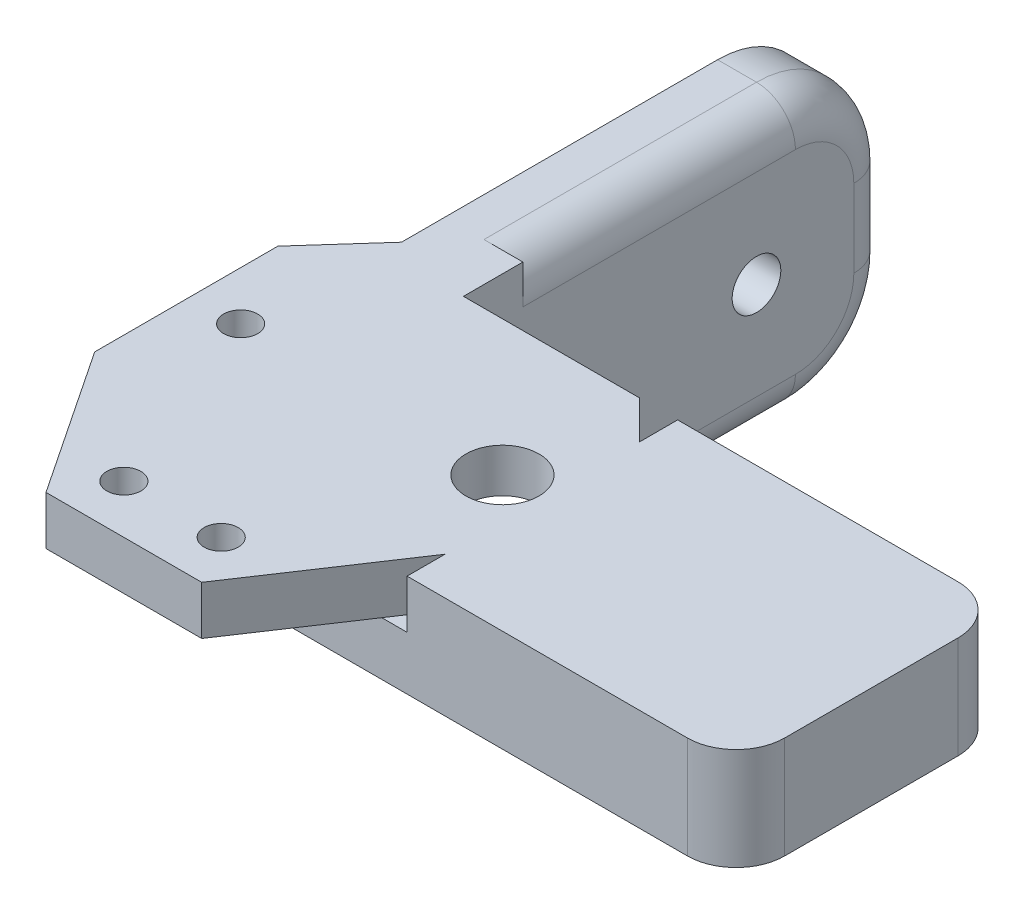
from build123d import *

# Parameters (mm, degrees)
SKETCH1_R               = 1.75
SKETCH1_W               = 7.2
SKETCH1_H               = 10.8
BOSS_EXTRUDE2_DEPTH     = 5
FILLET1_R               = 5.4
FILLET2_R               = 5.4
FILLET3_RADIUS          = 10
FILLET3_LENGTH          = 5
SKETCH2_W               = 35
SKETCH2_H               = 19.782608696
SKETCH2_W_2             = 23
SKETCH2_H_2             = 13
BOSS_EXTRUDE3_DEPTH     = 5.5
SKETCH3_W               = 23
SKETCH3_H               = 13
CUT_EXTRUDE1_DEPTH      = 3.5
CUT_EXTRUDE2_DEPTH      = 76.201396264
CUT_EXTRUDE2_DEPTH_BACK = 76.201396264
SKETCH6_W               = 13.4
SKETCH6_H               = 0.108695652
CUT_EXTRUDE3_DEPTH      = 13.5
SKETCH7_W               = 8
SKETCH7_H               = 28
BOSS_EXTRUDE5_DEPTH     = 38
SKETCH8_R               = 2.5
CUT_EXTRUDE4_DEPTH      = 32
FILLET5_R               = 10
SKETCH9_R               = 1
CUT_EXTRUDE5_DEPTH      = 7
BOSS_EXTRUDE6_START     = -8
BOSS_EXTRUDE6_DEPTH     = 8
CUT_EXTRUDE8_DEPTH      = 97.444595494
FILLET8_R               = 8
FILLET10_R              = 4
BOSS_EXTRUDE7_START     = -1.5
BOSS_EXTRUDE7_OUTLINE_W = 23
BOSS_EXTRUDE7_OUTLINE_H = 13
BOSS_EXTRUDE7_DEPTH     = 1.5
SKETCH15_R              = 1
BOSS_EXTRUDE8_DEPTH     = 7
SKETCH16_W              = 23
SKETCH16_H              = 13
BOSS_EXTRUDE9_DEPTH     = 9
SKETCH23_W              = 22.4
SKETCH23_H              = 19.782608696
BOSS_EXTRUDE11_DEPTH    = 10.5
SKETCH32_W              = 2
SKETCH32_H              = 19.782608696
CUT_EXTRUDE10_DEPTH     = 112.132758447
SKETCH33_W              = 21.6
SKETCH33_H              = 4.008695652
BOSS_EXTRUDE26_DEPTH    = 5.5
SKETCH34_W              = 33.8
SKETCH34_H              = 4.008695652
BOSS_EXTRUDE27_DEPTH    = 10.5
SKETCH39_W              = 41.4
SKETCH39_H              = 21
CUT_EXTRUDE15_DEPTH     = 6
SKETCH40_R              = 1
CUT_EXTRUDE16_DEPTH     = 7
SKETCH41_R              = 1.75
SKETCH41_R_2            = 3.75
CUT_EXTRUDE17_DEPTH     = 111.965264835
CUT_EXTRUDE18_DEPTH     = 10
FILLET12_R              = 5
BOSS_EXTRUDE28_REACH    = 109.184


with BuildPart() as part:
    # Sketch1 → Boss-Extrude2 (new body)
    # profile 1 of 2: a face of its own
    with BuildSketch(Plane(origin=(0, 0, 0), x_dir=(1, 0, 0), z_dir=(0, 1, 0))):
        Polygon((26, 45), (10, 45), (0, 33.819660113), (0, 15), (10, 0), (26, 0), (36, 15), (60, 15), (60, 35), (36, 35), align=None)
        with Locations(Location((13, 5, 0), (0, 0, 270))):
            Circle(SKETCH1_R, mode=Mode.SUBTRACT)
        with Locations(Location((23, 5, 0), (0, 0, 270))):
            Circle(SKETCH1_R, mode=Mode.SUBTRACT)
        with Locations(Location((5, 25, 0), (0, 0, 270))):
            Circle(SKETCH1_R, mode=Mode.SUBTRACT)
        Polygon((26.5, 30.4), (37.3, 30.4), (44.5, 30.4), (44.5, 19.6), (37.3, 19.6), (26.5, 19.6), align=None, mode=Mode.SUBTRACT)
    # profile 2 of 2: a face of its own
    with BuildSketch(Plane(origin=(0, 0, 0), x_dir=(1, 0, 0), z_dir=(0, 1, 0))):
        with Locations((40.9, 25)):
            Rectangle(SKETCH1_W, SKETCH1_H)
    extrude(amount=BOSS_EXTRUDE2_DEPTH)

    # Fillet1
    fillet1_edges = [part.edges().sort_by_distance(p)[0] for p in [
        (37.3, 2.5, -19.6),
        (37.3, 2.5, -30.4),
    ]]
    fillet(fillet1_edges, radius=FILLET1_R - 0.0001)  # a hair under: the kernel refuses the full size

    # Fillet2
    fillet2_edges = [part.edges().sort_by_distance(p)[0] for p in [
        (26.5, 2.5, -30.4),
        (26.5, 2.5, -19.6),
    ]]
    fillet(fillet2_edges, radius=FILLET2_R - 0.0001)  # a hair under: the kernel refuses the full size

    # Fillet3: full round fillet: the end face becomes a half cylinder, R = half its width
    fillet3_face = Plane((60, 2.5, -25), x_dir=(0, 1, 0), z_dir=(1, 0, 0))  # on the end face: x along it, z out of the body
    fillet3_slab = fillet3_face.offset(-FILLET3_RADIUS / 2) * Box(FILLET3_LENGTH, 2 * FILLET3_RADIUS, FILLET3_RADIUS, mode=Mode.PRIVATE)  # the body's end, R deep
    fillet3_round = Plane((50, 2.5, -25), x_dir=(1, 0, 0), z_dir=(0, 1, 0)) * Cylinder(FILLET3_RADIUS, FILLET3_LENGTH, mode=Mode.PRIVATE)  # its axis R under the face
    add(fillet3_slab - fillet3_round, mode=Mode.SUBTRACT)

    # Sketch2 → Boss-Extrude3 (add)
    with BuildSketch(Plane.XZ):
        with Locations((31.9, -25)):
            Rectangle(SKETCH2_W, SKETCH2_H)
        with Locations((31.9, -25)):
            Rectangle(SKETCH2_W_2, SKETCH2_H_2, mode=Mode.SUBTRACT)
    extrude(amount=BOSS_EXTRUDE3_DEPTH)

    # Sketch3 → Cut-Extrude1 (cut)
    with BuildSketch(Plane.XZ):
        with Locations((31.9, -25)):
            Rectangle(SKETCH3_W, SKETCH3_H)
    extrude(amount=-CUT_EXTRUDE1_DEPTH, mode=Mode.SUBTRACT)

    # Sketch4 → Cut-Extrude2 (cut, two sides: drawn at the far end of the back side and taken through both)
    with BuildSketch(Plane.XZ.offset(-CUT_EXTRUDE2_DEPTH_BACK)):
        with BuildLine():
            Line((49.4, -15), (49.4, -35))
            Line((49.4, -35), (50, -35))
            ThreePointArc((50, -35), (60, -25), (50, -15))
            Line((50, -15), (49.4, -15))
        make_face()
    extrude(amount=CUT_EXTRUDE2_DEPTH + CUT_EXTRUDE2_DEPTH_BACK, mode=Mode.SUBTRACT)

    # Sketch6 → Cut-Extrude3 (cut)
    with BuildSketch(Plane.XZ):
        with Locations((42.7, -34.945652174)):
            Rectangle(SKETCH6_W, SKETCH6_H)
        with Locations((42.7, -15.054347826)):
            Rectangle(SKETCH6_W, SKETCH6_H)
    extrude(amount=-CUT_EXTRUDE3_DEPTH, mode=Mode.SUBTRACT)

    # Sketch7 → Boss-Extrude5 (add)
    with BuildSketch(Plane(origin=(0, 0, -45), x_dir=(-1, 0, 0), z_dir=(0, 0, -1))):
        with Locations((-10, -9)):
            Rectangle(SKETCH7_W, SKETCH7_H)
    extrude(amount=BOSS_EXTRUDE5_DEPTH)

    # Sketch8 → Cut-Extrude4 (cut)
    with BuildSketch(Plane(origin=(14, 0, 0), x_dir=(0, 0, -1), z_dir=(1, 0, 0))):
        with Locations(Location((69, -9, 0), (0, 0, 90))):
            Circle(SKETCH8_R)
    extrude(amount=-CUT_EXTRUDE4_DEPTH, mode=Mode.SUBTRACT)

    # Fillet5
    fillet5_edges = [part.edges().sort_by_distance(p)[0] for p in [
        (10, -23, -83),
        (10, 5, -83),
    ]]
    fillet(fillet5_edges, radius=FILLET5_R)

    # Sketch9 → Cut-Extrude5 (cut)
    with BuildSketch(Plane.XZ.offset(5.5)):
        with Locations(Location((18.1, -25, 0), (0, 0, 270))):
            Circle(SKETCH9_R)
        with Locations(Location((45.7, -25, 0), (0, 0, 270))):
            Circle(SKETCH9_R)
    extrude(amount=-CUT_EXTRUDE5_DEPTH, mode=Mode.SUBTRACT)

    # Sketch10 → Boss-Extrude6 (add)
    with BuildSketch(Plane.ZY.offset(-6).offset(BOSS_EXTRUDE6_START)):
        Polygon((-45, -23), (-45, 5), (-34.891304348, 5), (-34.891304348, -5.5), align=None)
    extrude(amount=BOSS_EXTRUDE6_DEPTH)

    # Sketch13 → Cut-Extrude8 (cut, through all)
    with BuildSketch(Plane.ZY.offset(-6)):
        Polygon((-45, -23), (-34.891304348, -5.5), (-55, -23), align=None)
    extrude(amount=-CUT_EXTRUDE8_DEPTH, mode=Mode.SUBTRACT)

    # Fillet8
    fillet8_edges = [part.edges().sort_by_distance(p)[0] for p in [
        (10, -5.5, -34.891304348),
        (10, -23, -55),
    ]]
    fillet(fillet8_edges, radius=FILLET8_R)

    # Fillet10
    fillet10_edges = [part.edges().sort_by_distance(p)[0] for p in [
        (14, -9, -83),
        (14, -23, -65.496815266),
        (14, 5, -59),
        (14, -20.071067812, -80.071067812),
        (14, 2.071067812, -80.071067812),
        (14, -14.463184152, -45.19061533),
        (14, -0.928447255, -34.891304348),
        (14, -22.492592848, -55.189873693),
        (14, -5.172402248, -35.610685663),
    ]]
    fillet(fillet10_edges, radius=FILLET10_R)

    # Boss-Extrude7: read off the stored shape, not the designer's step
    # Boss-Extrude7 outline → Boss-Extrude7 (add)
    with BuildSketch(Plane.XZ.offset(-3.5).offset(BOSS_EXTRUDE7_START)):
        with Locations((31.9, -25)):
            Rectangle(BOSS_EXTRUDE7_OUTLINE_W, BOSS_EXTRUDE7_OUTLINE_H)
    extrude(amount=BOSS_EXTRUDE7_DEPTH)

    # Sketch15 → Boss-Extrude8 (add)
    with BuildSketch(Plane.XZ.offset(5.5)):
        with Locations((18.1, -25)):
            Circle(SKETCH15_R)
        with Locations((45.7, -25)):
            Circle(SKETCH15_R)
    extrude(amount=-BOSS_EXTRUDE8_DEPTH)

    # Sketch16 → Boss-Extrude9 (add)
    with BuildSketch(Plane.XZ.offset(-3.5)):
        with Locations((31.9, -25)):
            Rectangle(SKETCH16_W, SKETCH16_H)
    extrude(amount=BOSS_EXTRUDE9_DEPTH)

    # Sketch23 → Boss-Extrude11 (add)
    with BuildSketch(Plane.XZ.offset(5.5)):
        with Locations((60.6, -25)):
            Rectangle(SKETCH23_W, SKETCH23_H)
    extrude(amount=-BOSS_EXTRUDE11_DEPTH)

    # Sketch32 → Cut-Extrude10 (cut, through all)
    with BuildSketch(Plane.XZ.offset(5.5)):
        with Locations((70.8, -25)):
            Rectangle(SKETCH32_W, SKETCH32_H)
    extrude(amount=-CUT_EXTRUDE10_DEPTH, mode=Mode.SUBTRACT)

    # Sketch33 → Boss-Extrude26 (add)
    with BuildSketch(Plane.XZ.offset(5.5)):
        with Locations((25.2, -13.104347826)):
            Rectangle(SKETCH33_W, SKETCH33_H)
        with Locations((25.2, -36.895652174)):
            Rectangle(SKETCH33_W, SKETCH33_H)
    extrude(amount=-BOSS_EXTRUDE26_DEPTH)

    # Sketch34 → Boss-Extrude27 (add)
    with BuildSketch(Plane.XZ.offset(5.5)):
        with Locations((52.9, -13.104347826)):
            Rectangle(SKETCH34_W, SKETCH34_H)
        with Locations((52.9, -36.895652174)):
            Rectangle(SKETCH34_W, SKETCH34_H)
    extrude(amount=-BOSS_EXTRUDE27_DEPTH)

    # Sketch39 → Cut-Extrude15 (cut)
    with BuildSketch(Plane.XZ.offset(5.5)):
        with Locations((42.1, -25)):
            Rectangle(SKETCH39_W, SKETCH39_H)
    extrude(amount=-CUT_EXTRUDE15_DEPTH, mode=Mode.SUBTRACT)

    # Sketch40 → Cut-Extrude16 (cut)
    with BuildSketch(Plane.XZ.offset(5.5)):
        with Locations(Location((66.35, -30, 0), (0, 0, 270))):
            Circle(SKETCH40_R)
        with Locations(Location((66.35, -20, 0), (0, 0, 270))):
            Circle(SKETCH40_R)
        with Locations(Location((17.85, -30, 0), (0, 0, 270))):
            Circle(SKETCH40_R)
        with Locations(Location((17.85, -20, 0), (0, 0, 270))):
            Circle(SKETCH40_R)
    extrude(amount=-CUT_EXTRUDE16_DEPTH, mode=Mode.SUBTRACT)

    # Sketch41 → Cut-Extrude17 (cut, through all)
    with BuildSketch(Plane.XZ.offset(-0.5)):
        with Locations(Location((5, -25, 0), (0, 0, 90))):
            Circle(SKETCH41_R)
        with Locations(Location((31.9, -25, 0), (0, 0, 270))):
            Circle(SKETCH41_R_2)
    extrude(amount=-CUT_EXTRUDE17_DEPTH, mode=Mode.SUBTRACT)

    # Sketch42 → Cut-Extrude18 (cut)
    with BuildSketch(Plane(origin=(0, 0, 0), x_dir=(1, 0, 0), z_dir=(0, 1, 0))):
        Polygon((14, 45), (14, 38.891304348), (32.1, 38.9), (26, 45), align=None)
    extrude(amount=CUT_EXTRUDE18_DEPTH, mode=Mode.SUBTRACT)

    # Fillet12
    fillet12_edges = [part.edges().sort_by_distance(p)[0] for p in [
        (69.8, -0.25, -11.1),
        (69.8, -0.25, -38.9),
    ]]
    fillet(fillet12_edges, radius=FILLET12_R)

    # Boss-Extrude28: up to this face of the body (flat: up to its plane)
    boss_extrude28_end = Plane(part.part.faces().sort_by_distance((14.4, -2.75, -25))[0])
    # Sketch44 → Boss-Extrude28 (add, up to the picked face)
    with BuildSketch(Plane.ZY.offset(-6), mode=Mode.PRIVATE) as boss_extrude28_sk1:
        Polygon((-40.527864045, 0), (-34.78782211, 0), (-35.237020655, -4.368087235), (-35.768960465, -5.5), (-40.049862217, -5.5), align=None)
    boss_extrude28_tool1 = split(extrude(boss_extrude28_sk1.sketch, amount=-BOSS_EXTRUDE28_REACH, mode=Mode.PRIVATE), bisect_by=boss_extrude28_end, keep=Keep.BOTH, mode=Mode.PRIVATE)
    add(boss_extrude28_tool1.solids().sort_by(Axis((6, -2.637977, -37.697403), (1, 0, 0)))[0])


solid = part.part
